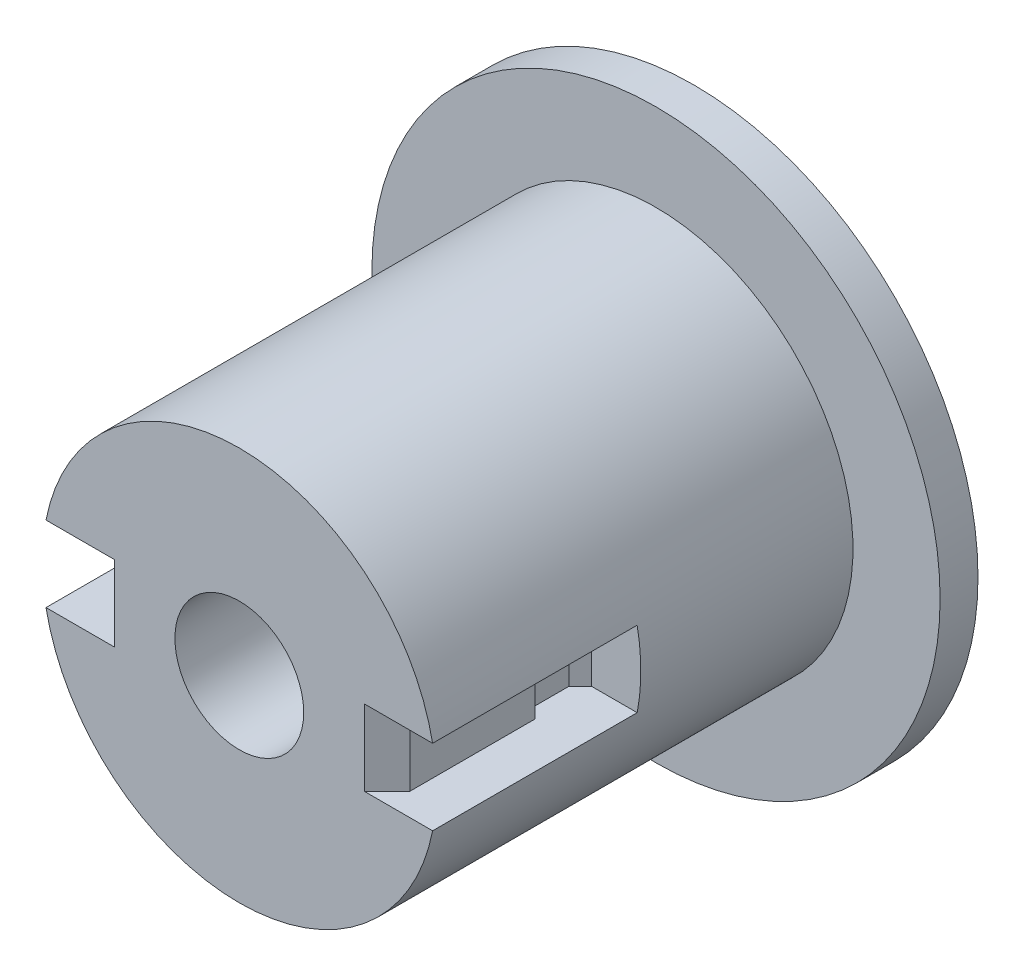
from build123d import *

# Parameters (mm, degrees)
AXLE_BASE_SKETCH_R        = 26
AXLE_DEPTH                = 55
GUARD_BASE_SKETCH_R       = 37.5
GUARD_BASE_DEPTH          = 5
INNER_AXLE_BASE_SKETCH_R  = 8.5
INNER_AXLE_HOLE_DEPTH     = 81.07808689
COUPLING_TOOTH_ROOM_DEPTH = 5


with BuildPart() as part:
    # Axle base sketch → Axle (new body)
    with BuildSketch(Plane.XY):
        Circle(AXLE_BASE_SKETCH_R)
    extrude(amount=AXLE_DEPTH)

    # Guard base sketch → Guard base (add)
    with BuildSketch(Plane(origin=(0, 0, 0), x_dir=(-1, 0, 0), z_dir=(0, 0, -1))):
        Circle(GUARD_BASE_SKETCH_R)
    extrude(amount=GUARD_BASE_DEPTH)

    # Inner axle base sketch → Inner axle hole (cut, through all)
    with BuildSketch(Plane.XY.offset(55)):
        Circle(INNER_AXLE_BASE_SKETCH_R)
    extrude(amount=-INNER_AXLE_HOLE_DEPTH, mode=Mode.SUBTRACT)

    # Coupling tooth base sketch → Coupling tooth room (cut, symmetric)
    with BuildSketch(Plane(origin=(0, 0, 0), x_dir=(1, 0, 0), z_dir=(0, 1, 0))):
        Polygon((19.5, -52), (16.5, -55), (26, -55), (26, -28), (19.5, -28), (18, -29.5), (18, -34), (19.5, -35.5), align=None)
    coupling_tooth_room = extrude(amount=COUPLING_TOOTH_ROOM_DEPTH, both=True, mode=Mode.SUBTRACT)

    # Coupling teeth: Coupling tooth room across plane
    add(coupling_tooth_room.mirror(Plane(origin=(0, 0, 0), x_dir=(0, 0, 1), z_dir=(1, 0, 0))), mode=Mode.SUBTRACT)


solid = part.part
